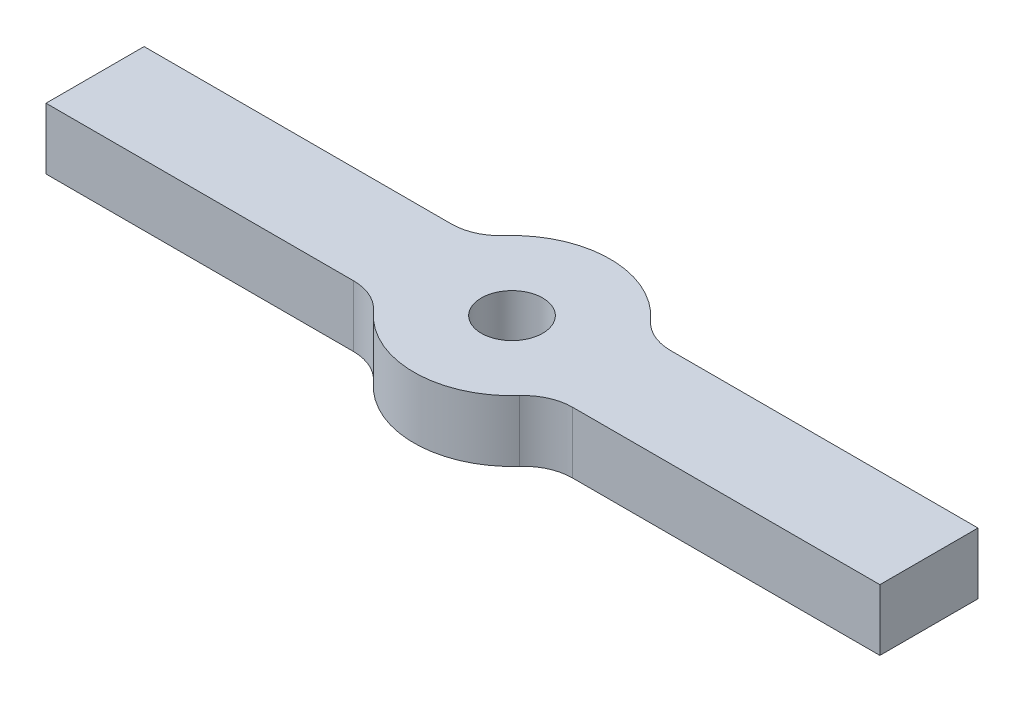
from build123d import *

# Parameters (mm, degrees)
SKETCH2_R           = 7.9375
BOSS_EXTRUDE1_DEPTH = 15.875
FILLET1_R           = 12.7
SKETCH3_R           = 22.225
CUT_EXTRUDE1_DEPTH  = 3.175


with BuildPart() as part:
    # Sketch2 → Boss-Extrude1 (new body)
    with BuildSketch(Plane(origin=(0, 0, 0), x_dir=(1, 0, 0), z_dir=(0, 1, 0))):
        with BuildLine():
            Line((-107.95, 0), (-107.95, -25.4))
            Line((-107.95, -25.4), (-21.997045256, -25.4))
            ThreePointArc((-21.997045256, -25.4), (0, -38.1), (21.997045256, -25.4))
            Line((21.997045256, -25.4), (107.95, -25.4))
            Line((107.95, -25.4), (107.95, 0))
            Line((107.95, 0), (21.997045256, 0))
            ThreePointArc((21.997045256, 0), (0, 12.7), (-21.997045256, 0))
            Line((-21.997045256, 0), (-107.95, 0))
        make_face()
        with Locations((0, -12.7)):
            Circle(SKETCH2_R, mode=Mode.SUBTRACT)
    extrude(amount=BOSS_EXTRUDE1_DEPTH)

    # Fillet1
    fillet1_edges = [part.edges().sort_by_distance(p)[0] for p in [
        (21.997045256, 7.9375, 0),
        (21.997045256, 7.9375, 25.4),
        (-21.997045256, 7.9375, 25.4),
        (-21.997045256, 7.9375, 0),
    ]]
    fillet(fillet1_edges, radius=FILLET1_R)

    # Sketch3 → Cut-Extrude1 (cut)
    with BuildSketch(Plane.XZ):
        with Locations((0, 12.7)):
            Circle(SKETCH3_R)
    extrude(amount=-CUT_EXTRUDE1_DEPTH, mode=Mode.SUBTRACT)


solid = part.part
